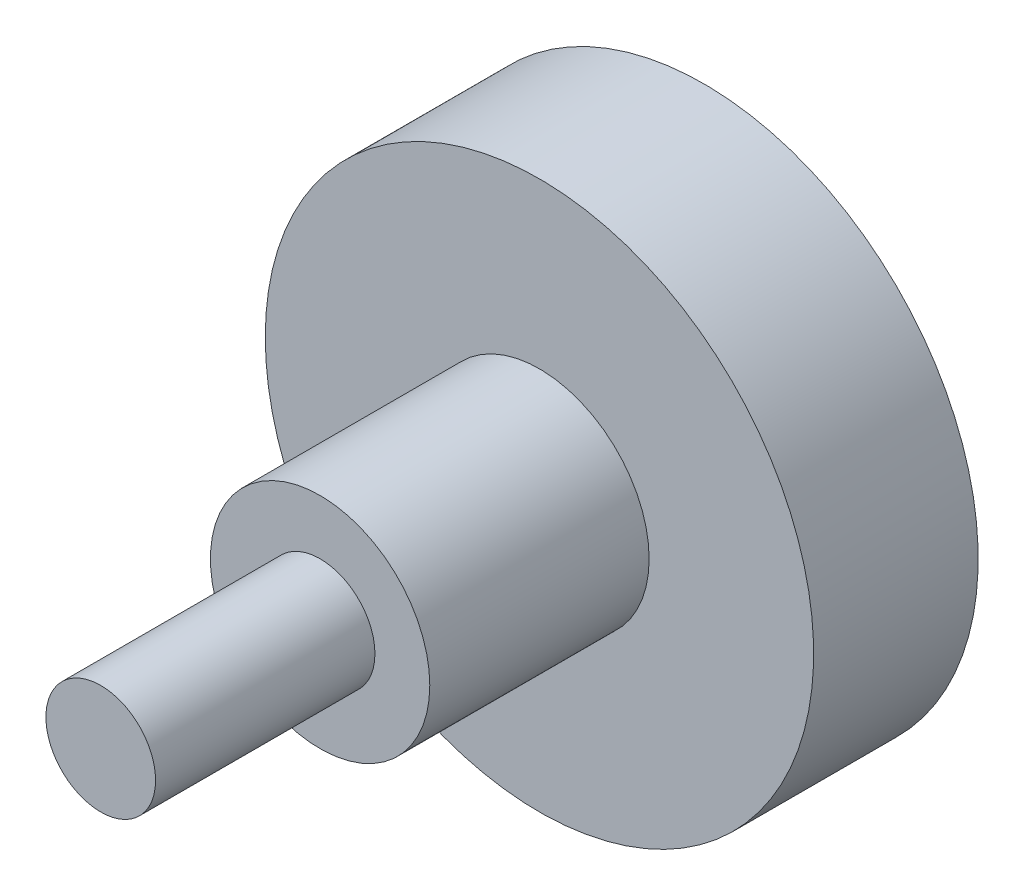
from build123d import *

# Parameters (mm, degrees)
SKETCH1_R      = 15.875
EXTRUDE1_DEPTH = 9.525
SKETCH2_R      = 6.35
EXTRUDE2_DEPTH = 12.7
SKETCH3_R      = 3.175
EXTRUDE3_DEPTH = 12.7


with BuildPart() as part:
    # Sketch1 → Extrude1 (new body)
    with BuildSketch(Plane.XY):
        Circle(SKETCH1_R)
    extrude(amount=EXTRUDE1_DEPTH)

    # Sketch2 → Extrude2 (add)
    with BuildSketch(Plane.XY.offset(9.525)):
        Circle(SKETCH2_R)
    extrude(amount=EXTRUDE2_DEPTH)

    # Sketch3 → Extrude3 (add)
    with BuildSketch(Plane.XY.offset(22.225)):
        Circle(SKETCH3_R)
    extrude(amount=EXTRUDE3_DEPTH)


solid = part.part
